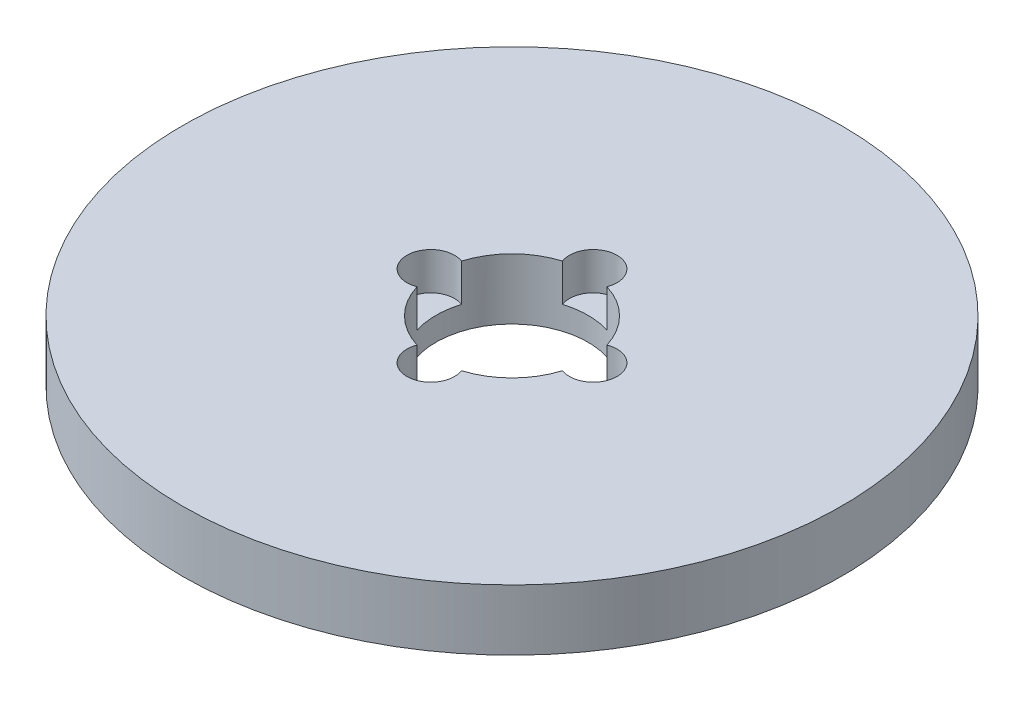
from build123d import *

# Parameters (mm, degrees)
SKETCH1_R           = 97.5
BOSS_EXTRUDE1_DEPTH = 18
SKETCH2_R           = 22.5
CUT_EXTRUDE1_DEPTH  = 140.055744218
SKETCH3_R           = 7.044283218
CUT_EXTRUDE2_DEPTH  = 11.099177093
CIRPATTERN1_COUNT   = 4


with BuildPart() as part:
    # Sketch1 → Boss-Extrude1 (new body)
    with BuildSketch(Plane(origin=(0, 0, 0), x_dir=(1, 0, 0), z_dir=(0, 1, 0))):
        Circle(SKETCH1_R)
    extrude(amount=BOSS_EXTRUDE1_DEPTH)

    # Sketch2 → Cut-Extrude1 (cut, through all)
    with BuildSketch(Plane(origin=(0, 0, 0), x_dir=(1, 0, 0), z_dir=(0, 1, 0))):
        Circle(SKETCH2_R)
    extrude(amount=CUT_EXTRUDE1_DEPTH, mode=Mode.SUBTRACT)

    # Sketch3 → Cut-Extrude2 (cut)
    with BuildSketch(Plane(origin=(0, 18, 0), x_dir=(1, 0, 0), z_dir=(0, 1, 0))):
        with Locations((-24.039797539, 0)):
            Circle(SKETCH3_R)
    cut_extrude2 = extrude(amount=-CUT_EXTRUDE2_DEPTH, mode=Mode.SUBTRACT)

    # CirPattern1: Cut-Extrude2 ×4 about axis
    cirpattern1_axis = Axis((0, 0, 0), (0, 1, 0))
    for i in range(1, CIRPATTERN1_COUNT):
        add(cut_extrude2.rotate(cirpattern1_axis, i * 360 / CIRPATTERN1_COUNT), mode=Mode.SUBTRACT)


solid = part.part
